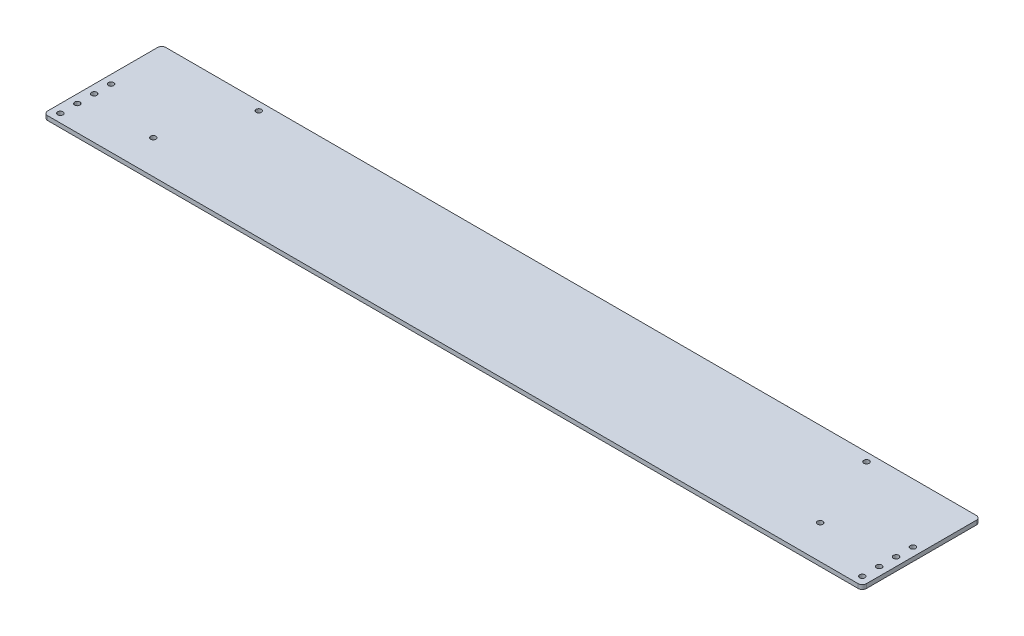
from build123d import *

# Parameters (mm, degrees)
SKETCH1_W           = 615.95
SKETCH1_H           = 88.9
SKETCH1_R           = 2.0193
BOSS_EXTRUDE1_DEPTH = 3.175
FILLET1_R           = 3.175
SKETCH2_R           = 2.0193
CUT_EXTRUDE1_DEPTH  = 312.182396273


with BuildPart() as part:
    # Sketch1 → Boss-Extrude1 (new body)
    with BuildSketch(Plane(origin=(0, 0, 0), x_dir=(1, 0, 0), z_dir=(0, 1, 0))):
        Rectangle(SKETCH1_W, SKETCH1_H)
        with Locations((-301.625, 0)):
            Circle(SKETCH1_R, mode=Mode.SUBTRACT)
        with Locations((-301.625, -12.7)):
            Circle(SKETCH1_R, mode=Mode.SUBTRACT)
        with Locations((-301.625, -25.4)):
            Circle(SKETCH1_R, mode=Mode.SUBTRACT)
        with Locations((-301.625, -38.1)):
            Circle(SKETCH1_R, mode=Mode.SUBTRACT)
        with Locations((301.625, -38.1)):
            Circle(SKETCH1_R, mode=Mode.SUBTRACT)
        with Locations((301.625, -25.4)):
            Circle(SKETCH1_R, mode=Mode.SUBTRACT)
        with Locations((301.625, -12.7)):
            Circle(SKETCH1_R, mode=Mode.SUBTRACT)
        with Locations((301.625, 0)):
            Circle(SKETCH1_R, mode=Mode.SUBTRACT)
    extrude(amount=BOSS_EXTRUDE1_DEPTH)

    # Fillet1
    fillet1_edges = [part.edges().sort_by_distance(p)[0] for p in [
        (307.975, 1.5875, 44.45),
        (-307.975, 1.5875, -44.45),
        (307.975, 1.5875, -44.45),
        (-307.975, 1.5875, 44.45),
    ]]
    fillet(fillet1_edges, radius=FILLET1_R)

    # Sketch2 → Cut-Extrude1 (cut, through all)
    with BuildSketch(Plane(origin=(0, 3.175, 0), x_dir=(1, 0, 0), z_dir=(0, 1, 0))):
        with Locations((-228.6, 38.1)):
            Circle(SKETCH2_R)
        with Locations((-250.825, -19.05)):
            Circle(SKETCH2_R)
        with Locations((250.825, -19.05)):
            Circle(SKETCH2_R)
        with Locations((228.6, 38.1)):
            Circle(SKETCH2_R)
    extrude(amount=-CUT_EXTRUDE1_DEPTH, mode=Mode.SUBTRACT)


solid = part.part
